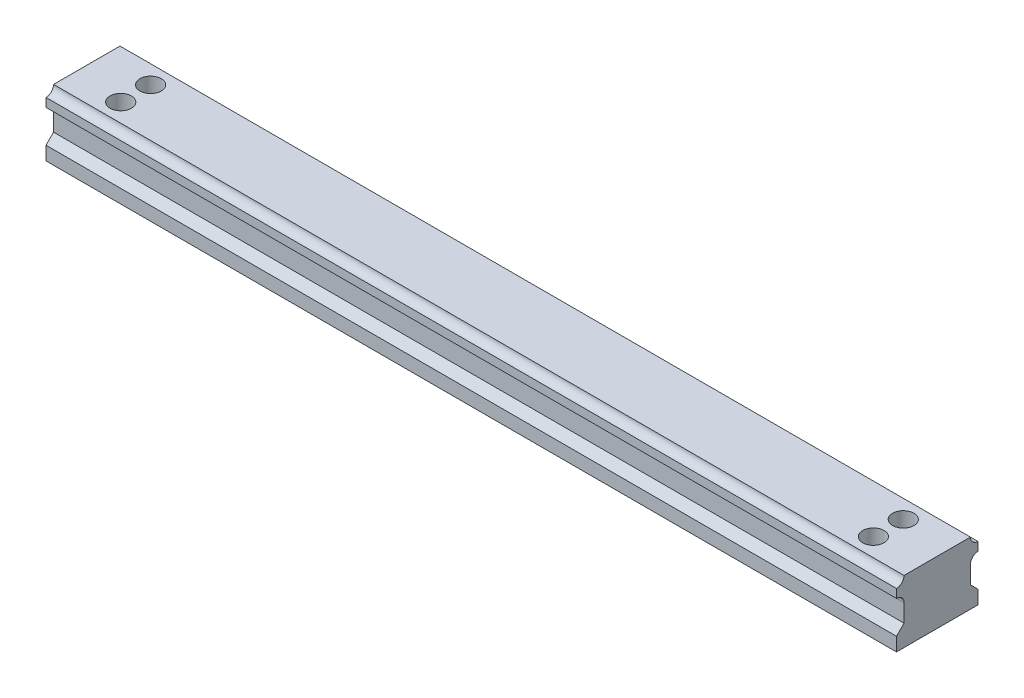
from build123d import *

# Parameters (mm, degrees)
BOSS_EXTRUDE1_DEPTH = 312.997959
SKETCH2_R           = 1.9177
CUT_EXTRUDE1_DEPTH  = 316.27245731
SKETCH3_R           = 3.93065
CUT_EXTRUDE2_DEPTH  = 7.302


with BuildPart() as part:
    # Sketch1 → Boss-Extrude1 (new body)
    with BuildSketch(Plane(origin=(0, 0, 0), x_dir=(0, 0, -1), z_dir=(1, 0, 0))):
        with BuildLine():
            Line((0, 0), (30, 0))
            Line((30, 0), (30, 5))
            Line((30, 5), (27.221875, 7.778125))
            Line((27.221875, 7.778125), (27.221875, 14.278125))
            ThreePointArc((27.221875, 14.278125), (28.035568974, 16.242556026), (30, 17.05625))
            Line((30, 17.05625), (30, 20.221875))
            ThreePointArc((30, 20.221875), (28.035568974, 21.035568974), (27.221875, 23))
            Line((27.221875, 23), (2.778125, 23))
            ThreePointArc((2.778125, 23), (1.964431026, 21.035568974), (0, 20.221875))
            Line((0, 20.221875), (0, 17.05625))
            ThreePointArc((0, 17.05625), (1.964431026, 16.242556026), (2.778125, 14.278125))
            Line((2.778125, 14.278125), (2.778125, 7.778125))
            Line((2.778125, 7.778125), (0, 5))
            Line((0, 5), (0, 0))
        make_face()
    extrude(amount=BOSS_EXTRUDE1_DEPTH)

    # Sketch2 → Cut-Extrude1 (cut, through all)
    with BuildSketch(Plane(origin=(0, 23, 0), x_dir=(1, 0, 0), z_dir=(0, 1, 0))):
        with Locations((294.997959, 20.5)):
            Circle(SKETCH2_R)
        with Locations((294.997959, 9.5)):
            Circle(SKETCH2_R)
        with Locations((18, 9.5)):
            Circle(SKETCH2_R)
        with Locations((18, 20.5)):
            Circle(SKETCH2_R)
    extrude(amount=-CUT_EXTRUDE1_DEPTH, mode=Mode.SUBTRACT)

    # Sketch3 → Cut-Extrude2 (cut)
    with BuildSketch(Plane(origin=(0, 23, 0), x_dir=(1, 0, 0), z_dir=(0, 1, 0))):
        with Locations((18, 20.5)):
            Circle(SKETCH3_R)
        with Locations((18, 9.5)):
            Circle(SKETCH3_R)
        with Locations((294.997959, 9.5)):
            Circle(SKETCH3_R)
        with Locations((294.997959, 20.5)):
            Circle(SKETCH3_R)
    extrude(amount=-CUT_EXTRUDE2_DEPTH, mode=Mode.SUBTRACT)


solid = part.part
